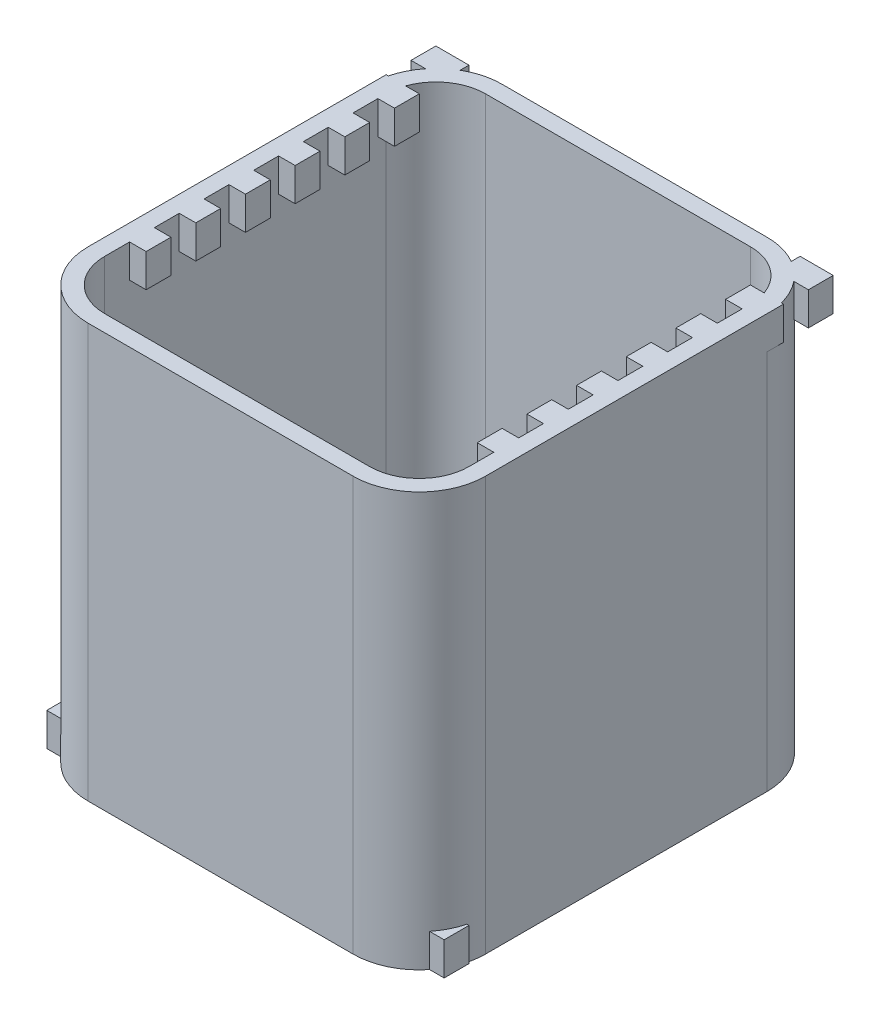
from build123d import *

# Parameters (mm, degrees)
BOSS_EXTRUDE1_DEPTH = 250
SKETCH3_W           = 15
SKETCH3_H           = 20
BOSS_EXTRUDE2_DEPTH = 20
SKETCH4_W           = 15
SKETCH4_H           = 20
BOSS_EXTRUDE3_DEPTH = 20
SKETCH8_W           = 15
SKETCH8_H           = 20
BOSS_EXTRUDE5_DEPTH = 20
SKETCH9_W           = 15
SKETCH9_H           = 20
BOSS_EXTRUDE6_DEPTH = 20


with BuildPart() as part:
    # Sketch1 → Boss-Extrude1 (new body)
    with BuildSketch(Plane(origin=(0, 0, 0), x_dir=(1, 0, 0), z_dir=(0, 1, 0))):
        with BuildLine():
            Line((-10, 30), (-10, 200))
            ThreePointArc((-10, 200), (1.715728753, 228.284271247), (30, 240))
            Line((30, 240), (190, 240))
            ThreePointArc((190, 240), (218.284271247, 228.284271247), (230, 200))
            Line((230, 200), (230, 30))
            ThreePointArc((230, 30), (218.284271247, 1.715728753), (190, -10))
            Line((190, -10), (30, -10))
            ThreePointArc((30, -10), (1.715728753, 1.715728753), (-10, 30))
        make_face()
        with BuildLine():
            Line((30, 0), (190, 0))
            ThreePointArc((190, 0), (211.213203436, 8.786796564), (220, 30))
            Line((220, 30), (220, 200))
            ThreePointArc((220, 200), (211.213203436, 221.213203436), (190, 230))
            Line((190, 230), (30, 230))
            ThreePointArc((30, 230), (8.786796564, 221.213203436), (0, 200))
            Line((0, 200), (0, 30))
            ThreePointArc((0, 30), (8.786796564, 8.786796564), (30, 0))
        make_face(mode=Mode.SUBTRACT)
    extrude(amount=BOSS_EXTRUDE1_DEPTH)

    # Sketch3 → Boss-Extrude2 (add)
    with BuildSketch(Plane.ZY.offset(10)):
        with Locations((-192.5, 10)):
            Rectangle(SKETCH3_W, SKETCH3_H)
        with Locations((-162.5, 10)):
            Rectangle(SKETCH3_W, SKETCH3_H)
        with Locations((-132.5, 10)):
            Rectangle(SKETCH3_W, SKETCH3_H)
        with Locations((-102.5, 10)):
            Rectangle(SKETCH3_W, SKETCH3_H)
        with Locations((-72.5, 10)):
            Rectangle(SKETCH3_W, SKETCH3_H)
        with Locations((-42.5, 10)):
            Rectangle(SKETCH3_W, SKETCH3_H)
        with Locations((-12.5, 10)):
            Rectangle(SKETCH3_W, SKETCH3_H)
    extrude(amount=-BOSS_EXTRUDE2_DEPTH)

    # Sketch4 → Boss-Extrude3 (add)
    with BuildSketch(Plane(origin=(230, 0, 0), x_dir=(0, 0, -1), z_dir=(1, 0, 0))):
        with Locations((192.5, 10)):
            Rectangle(SKETCH4_W, SKETCH4_H)
        with Locations((162.5, 10)):
            Rectangle(SKETCH4_W, SKETCH4_H)
        with Locations((132.5, 10)):
            Rectangle(SKETCH4_W, SKETCH4_H)
        with Locations((102.5, 10)):
            Rectangle(SKETCH4_W, SKETCH4_H)
        with Locations((72.5, 10)):
            Rectangle(SKETCH4_W, SKETCH4_H)
        with Locations((42.5, 10)):
            Rectangle(SKETCH4_W, SKETCH4_H)
        with Locations((12.5, 10)):
            Rectangle(SKETCH4_W, SKETCH4_H)
    extrude(amount=-BOSS_EXTRUDE3_DEPTH)

    # Sketch8 → Boss-Extrude5 (add)
    with BuildSketch(Plane(origin=(-10, 0, 0), x_dir=(0, 0, -1), z_dir=(1, 0, 0))):
        with Locations((52.5, 240)):
            Rectangle(SKETCH8_W, SKETCH8_H)
        with Locations((82.5, 240)):
            Rectangle(SKETCH8_W, SKETCH8_H)
        with Locations((112.5, 240)):
            Rectangle(SKETCH8_W, SKETCH8_H)
        with Locations((142.5, 240)):
            Rectangle(SKETCH8_W, SKETCH8_H)
        with Locations((172.5, 240)):
            Rectangle(SKETCH8_W, SKETCH8_H)
        with Locations((202.5, 240)):
            Rectangle(SKETCH8_W, SKETCH8_H)
        with Locations((232.5, 240)):
            Rectangle(SKETCH8_W, SKETCH8_H)
    extrude(amount=BOSS_EXTRUDE5_DEPTH)

    # Sketch9 → Boss-Extrude6 (add)
    with BuildSketch(Plane(origin=(230, 0, 0), x_dir=(0, 0, -1), z_dir=(1, 0, 0))):
        with Locations((52.5, 240)):
            Rectangle(SKETCH9_W, SKETCH9_H)
        with Locations((82.5, 240)):
            Rectangle(SKETCH9_W, SKETCH9_H)
        with Locations((112.5, 240)):
            Rectangle(SKETCH9_W, SKETCH9_H)
        with Locations((142.5, 240)):
            Rectangle(SKETCH9_W, SKETCH9_H)
        with Locations((172.5, 240)):
            Rectangle(SKETCH9_W, SKETCH9_H)
        with Locations((202.5, 240)):
            Rectangle(SKETCH9_W, SKETCH9_H)
        with Locations((232.5, 240)):
            Rectangle(SKETCH9_W, SKETCH9_H)
    extrude(amount=-BOSS_EXTRUDE6_DEPTH)


solid = part.part
